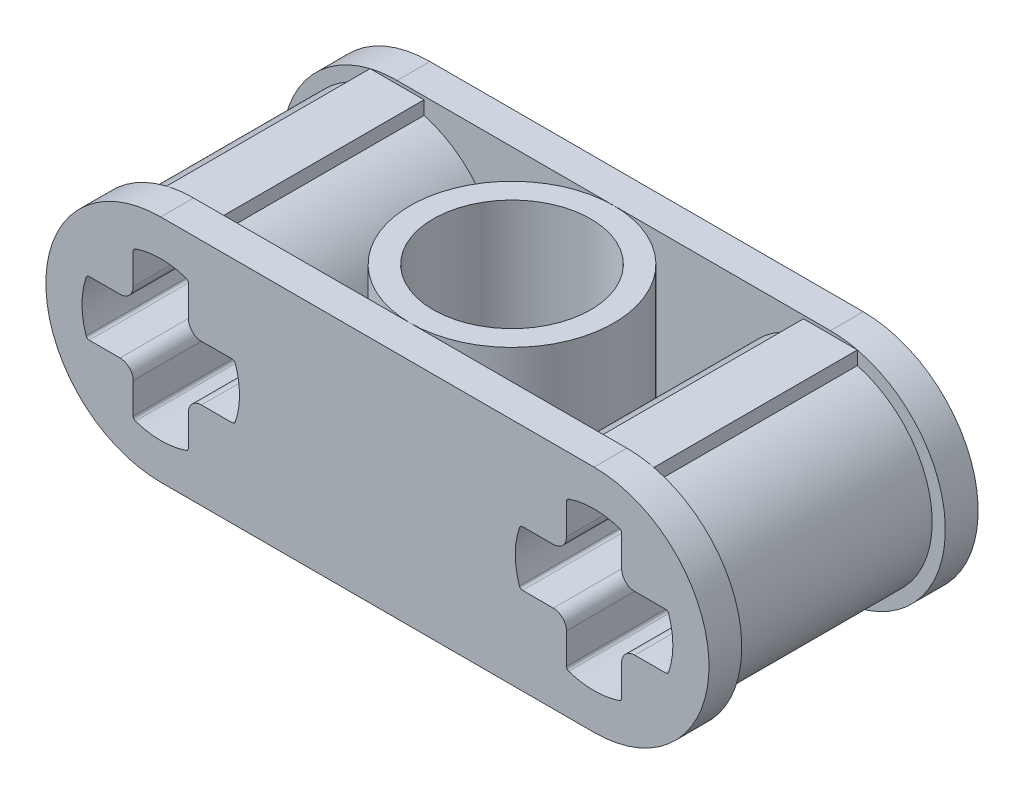
from build123d import *

# Parameters (mm, degrees)
BOSS_EXTRUDE1_DEPTH      = 10
BOSS_EXTRUDE2_DEPTH      = 35
BOSS_EXTRUDE2_DEPTH_BACK = 35
SKETCH2_R                = 31
SKETCH3_R                = 31
BOSS_EXTRUDE3_DEPTH      = 41
CUT_EXTRUDE1_DEPTH       = 41
FILLET1_R                = 4
FILLET2_R                = 4
FILLET3_R                = 4
FILLET4_R                = 4
FILLET5_R                = 1
FILLET6_R                = 1
FILLET7_R                = 1
FILLET8_R                = 1
FILLET9_R                = 1
FILLET10_R               = 1
FILLET11_R               = 1
FILLET12_R               = 1
BOSS_EXTRUDE4_DEPTH      = 41
MIRROR2_DEPTH            = 10
MIRROR2_START            = -31
MIRROR2_2_DEPTH          = 31
SKETCH6_R                = 24
CUT_EXTRUDE2_DEPTH       = 138.640836963
MIRROR3_START            = -72
MIRROR3_DEPTH            = 41
MIRROR3_2_DEPTH          = 10
SCALE1_SCALE             = 0.1


# Read off the part's stored shape, not the designer's step: Mirror2, Mirror3
with BuildPart() as part:
    # Sketch1 → Boss-Extrude1 (new body)
    with BuildSketch(Plane.XY):
        with BuildLine():
            Line((-66, 35), (66, 35))
            ThreePointArc((66, 35), (101, 0), (66, -35))
            Line((66, -35), (-66, -35))
            ThreePointArc((-66, -35), (-101, 0), (-66, 35))
        make_face()
    extrude(amount=BOSS_EXTRUDE1_DEPTH)

    # Sketch3 → Boss-Extrude3 (add)
    with BuildSketch(Plane.XY.offset(10)):
        with Locations((-66, 0)):
            Circle(SKETCH3_R)
    extrude(amount=-BOSS_EXTRUDE3_DEPTH)

    # Sketch4 → Cut-Extrude1 (cut)
    with BuildSketch(Plane.XY.offset(10)):
        with BuildLine():
            Line((-57.6, -8.4), (-43.518007206, -8.4))
            ThreePointArc((-43.518007206, -8.4), (-42, 0), (-43.518007206, 8.4))
            Line((-43.518007206, 8.4), (-57.6, 8.4))
            Line((-57.6, 8.4), (-57.6, 22.481992794))
            ThreePointArc((-57.6, 22.481992794), (-66, 24), (-74.4, 22.481992794))
            Line((-74.4, 22.481992794), (-74.4, 8.4))
            Line((-74.4, 8.4), (-88.481992794, 8.4))
            ThreePointArc((-88.481992794, 8.4), (-90, 0), (-88.481992794, -8.4))
            Line((-88.481992794, -8.4), (-74.4, -8.4))
            Line((-74.4, -8.4), (-74.4, -22.481992794))
            ThreePointArc((-74.4, -22.481992794), (-66, -24), (-57.6, -22.481992794))
            Line((-57.6, -22.481992794), (-57.6, -8.4))
        make_face()
    extrude(amount=-CUT_EXTRUDE1_DEPTH, mode=Mode.SUBTRACT)

    # Fillet1
    fillet1_edges = [part.edges().sort_by_distance(p)[0] for p in [
        (-57.6, 8.4, -10.5),
    ]]
    fillet(fillet1_edges, radius=FILLET1_R)

    # Fillet2
    fillet2_edges = [part.edges().sort_by_distance(p)[0] for p in [
        (-57.6, -8.4, -10.5),
    ]]
    fillet(fillet2_edges, radius=FILLET2_R)

    # Fillet3
    fillet3_edges = [part.edges().sort_by_distance(p)[0] for p in [
        (-74.4, -8.4, -10.5),
    ]]
    fillet(fillet3_edges, radius=FILLET3_R)

    # Fillet4
    fillet4_edges = [part.edges().sort_by_distance(p)[0] for p in [
        (-74.4, 8.4, -10.5),
    ]]
    fillet(fillet4_edges, radius=FILLET4_R)

    # Fillet5
    fillet5_edges = [part.edges().sort_by_distance(p)[0] for p in [
        (-74.4, -22.481992794, -10.5),
    ]]
    fillet(fillet5_edges, radius=FILLET5_R)

    # Fillet6
    fillet6_edges = [part.edges().sort_by_distance(p)[0] for p in [
        (-57.6, -22.481992794, -10.5),
    ]]
    fillet(fillet6_edges, radius=FILLET6_R)

    # Fillet7
    fillet7_edges = [part.edges().sort_by_distance(p)[0] for p in [
        (-43.518007206, -8.4, -10.5),
    ]]
    fillet(fillet7_edges, radius=FILLET7_R)

    # Fillet8
    fillet8_edges = [part.edges().sort_by_distance(p)[0] for p in [
        (-43.518007206, 8.4, -10.5),
    ]]
    fillet(fillet8_edges, radius=FILLET8_R)

    # Fillet9
    fillet9_edges = [part.edges().sort_by_distance(p)[0] for p in [
        (-88.481992794, -8.4, -10.5),
    ]]
    fillet(fillet9_edges, radius=FILLET9_R)

    # Fillet10
    fillet10_edges = [part.edges().sort_by_distance(p)[0] for p in [
        (-88.481992794, 8.4, -10.5),
    ]]
    fillet(fillet10_edges, radius=FILLET10_R)

    # Fillet11
    fillet11_edges = [part.edges().sort_by_distance(p)[0] for p in [
        (-74.4, 22.481992794, -10.5),
    ]]
    fillet(fillet11_edges, radius=FILLET11_R)

    # Fillet12
    fillet12_edges = [part.edges().sort_by_distance(p)[0] for p in [
        (-57.6, 22.481992794, -10.5),
    ]]
    fillet(fillet12_edges, radius=FILLET12_R)

    # Sketch5 → Boss-Extrude4 (add)
    with BuildSketch(Plane.XY.offset(10)):
        with BuildLine():
            Line((-74.212938845, 22.359401208), (-74.212938845, 34.022751734))
            Line((-74.212938845, 34.022751734), (-57.787061155, 34.022751734))
            Line((-57.787061155, 34.022751734), (-57.787061155, 22.359401208))
            ThreePointArc((-57.787061155, 22.359401208), (-58.004110065, 22.580118257), (-58.27826087, 22.723880496))
            ThreePointArc((-58.27826087, 22.723880496), (-66, 24), (-73.72173913, 22.723880496))
            ThreePointArc((-73.72173913, 22.723880496), (-73.995889935, 22.580118257), (-74.212938845, 22.359401208))
        make_face()
    boss_extrude4 = extrude(amount=-BOSS_EXTRUDE4_DEPTH)

    # Mirror1: Boss-Extrude4 across plane
    add(boss_extrude4.mirror(Plane.ZX))

    # Mirror2 outline → Mirror2 (cut)
    with BuildSketch(Plane.XY):
        with BuildLine():
            Line((44.222947858, -8.4), (53.6, -8.4))
            ThreePointArc((53.6, -8.4), (56.428427125, -9.571572875), (57.6, -12.4))
            Line((57.6, -12.4), (57.6, -21.777052142))
            ThreePointArc((57.6, -21.777052142), (57.787061155, -22.359401208), (58.27826087, -22.723880496))
            ThreePointArc((58.27826087, -22.723880496), (66, -24), (73.72173913, -22.723880496))
            ThreePointArc((73.72173913, -22.723880496), (74.212938845, -22.359401208), (74.4, -21.777052142))
            Line((74.4, -21.777052142), (74.4, -12.4))
            ThreePointArc((74.4, -12.4), (75.571572875, -9.571572875), (78.4, -8.4))
            Line((78.4, -8.4), (87.777052142, -8.4))
            ThreePointArc((87.777052142, -8.4), (88.359401208, -8.212938845), (88.723880496, -7.72173913))
            ThreePointArc((88.723880496, -7.72173913), (90, 0), (88.723880496, 7.72173913))
            ThreePointArc((88.723880496, 7.72173913), (88.359401208, 8.212938845), (87.777052142, 8.4))
            Line((87.777052142, 8.4), (78.4, 8.4))
            ThreePointArc((78.4, 8.4), (75.571572875, 9.571572875), (74.4, 12.4))
            Line((74.4, 12.4), (74.4, 21.777052142))
            ThreePointArc((74.4, 21.777052142), (74.212938845, 22.359401208), (73.72173913, 22.723880496))
            ThreePointArc((73.72173913, 22.723880496), (66, 24), (58.27826087, 22.723880496))
            ThreePointArc((58.27826087, 22.723880496), (57.787061155, 22.359401208), (57.6, 21.777052142))
            Line((57.6, 21.777052142), (57.6, 12.4))
            ThreePointArc((57.6, 12.4), (56.428427125, 9.571572875), (53.6, 8.4))
            Line((53.6, 8.4), (44.222947858, 8.4))
            ThreePointArc((44.222947858, 8.4), (43.640598792, 8.212938845), (43.276119504, 7.72173913))
            ThreePointArc((43.276119504, 7.72173913), (42, 0), (43.276119504, -7.72173913))
            ThreePointArc((43.276119504, -7.72173913), (43.640598792, -8.212938845), (44.222947858, -8.4))
        make_face()
    extrude(amount=MIRROR2_DEPTH, mode=Mode.SUBTRACT)

    # Mirror2 2 outline → Mirror2 2 (add)
    with BuildSketch(Plane.XY.offset(MIRROR2_START)):
        with BuildLine():
            Line((74.212938845, -34.022751734), (74.212938845, -29.892267153))
            ThreePointArc((74.212938845, -29.892267153), (97, 0), (74.212938845, 29.892267153))
            Line((74.212938845, 29.892267153), (74.212938845, 34.022751734))
            Line((74.212938845, 34.022751734), (57.787061155, 34.022751734))
            Line((57.787061155, 34.022751734), (57.787061155, 29.892267153))
            ThreePointArc((57.787061155, 29.892267153), (35, 0), (57.787061155, -29.892267153))
            Line((57.787061155, -29.892267153), (57.787061155, -34.022751734))
            Line((57.787061155, -34.022751734), (74.212938845, -34.022751734))
        make_face()
        with BuildLine():
            ThreePointArc((57.6, -12.4), (56.428427125, -9.571572875), (53.6, -8.4))
            Line((53.6, -8.4), (44.222947858, -8.4))
            ThreePointArc((44.222947858, -8.4), (43.640598792, -8.212938845), (43.276119504, -7.72173913))
            ThreePointArc((43.276119504, -7.72173913), (42, 0), (43.276119504, 7.72173913))
            ThreePointArc((43.276119504, 7.72173913), (43.640598792, 8.212938845), (44.222947858, 8.4))
            Line((44.222947858, 8.4), (53.6, 8.4))
            ThreePointArc((53.6, 8.4), (56.428427125, 9.571572875), (57.6, 12.4))
            Line((57.6, 12.4), (57.6, 21.777052142))
            ThreePointArc((57.6, 21.777052142), (57.787061155, 22.359401208), (58.27826087, 22.723880496))
            ThreePointArc((58.27826087, 22.723880496), (66, 24), (73.72173913, 22.723880496))
            ThreePointArc((73.72173913, 22.723880496), (74.212938845, 22.359401208), (74.4, 21.777052142))
            Line((74.4, 21.777052142), (74.4, 12.4))
            ThreePointArc((74.4, 12.4), (75.571572875, 9.571572875), (78.4, 8.4))
            Line((78.4, 8.4), (87.777052142, 8.4))
            ThreePointArc((87.777052142, 8.4), (88.359401208, 8.212938845), (88.723880496, 7.72173913))
            ThreePointArc((88.723880496, 7.72173913), (90, 0), (88.723880496, -7.72173913))
            ThreePointArc((88.723880496, -7.72173913), (88.359401208, -8.212938845), (87.777052142, -8.4))
            Line((87.777052142, -8.4), (78.4, -8.4))
            ThreePointArc((78.4, -8.4), (75.571572875, -9.571572875), (74.4, -12.4))
            Line((74.4, -12.4), (74.4, -21.777052142))
            ThreePointArc((74.4, -21.777052142), (74.212938845, -22.359401208), (73.72173913, -22.723880496))
            ThreePointArc((73.72173913, -22.723880496), (66, -24), (58.27826087, -22.723880496))
            ThreePointArc((58.27826087, -22.723880496), (57.787061155, -22.359401208), (57.6, -21.777052142))
            Line((57.6, -21.777052142), (57.6, -12.4))
        make_face(mode=Mode.SUBTRACT)
    extrude(amount=MIRROR2_2_DEPTH)

    # Mirror3 outline → Mirror3 (add)
    # profile 1 of 2: a face of its own
    with BuildSketch(Plane.XY.offset(MIRROR3_START)):
        with BuildLine():
            Line((74.212938845, -34.022751734), (74.212938845, -29.892267153))
            ThreePointArc((74.212938845, -29.892267153), (97, 0), (74.212938845, 29.892267153))
            Line((74.212938845, 29.892267153), (74.212938845, 34.022751734))
            Line((74.212938845, 34.022751734), (57.787061155, 34.022751734))
            Line((57.787061155, 34.022751734), (57.787061155, 29.892267153))
            ThreePointArc((57.787061155, 29.892267153), (35, 0), (57.787061155, -29.892267153))
            Line((57.787061155, -29.892267153), (57.787061155, -34.022751734))
            Line((57.787061155, -34.022751734), (74.212938845, -34.022751734))
        make_face()
        with BuildLine():
            ThreePointArc((57.6, -12.4), (56.428427125, -9.571572875), (53.6, -8.4))
            Line((53.6, -8.4), (44.222947858, -8.4))
            ThreePointArc((44.222947858, -8.4), (43.640598792, -8.212938845), (43.276119504, -7.72173913))
            ThreePointArc((43.276119504, -7.72173913), (42, 0), (43.276119504, 7.72173913))
            ThreePointArc((43.276119504, 7.72173913), (43.640598792, 8.212938845), (44.222947858, 8.4))
            Line((44.222947858, 8.4), (53.6, 8.4))
            ThreePointArc((53.6, 8.4), (56.428427125, 9.571572875), (57.6, 12.4))
            Line((57.6, 12.4), (57.6, 21.777052142))
            ThreePointArc((57.6, 21.777052142), (57.787061155, 22.359401208), (58.27826087, 22.723880496))
            ThreePointArc((58.27826087, 22.723880496), (66, 24), (73.72173913, 22.723880496))
            ThreePointArc((73.72173913, 22.723880496), (74.212938845, 22.359401208), (74.4, 21.777052142))
            Line((74.4, 21.777052142), (74.4, 12.4))
            ThreePointArc((74.4, 12.4), (75.571572875, 9.571572875), (78.4, 8.4))
            Line((78.4, 8.4), (87.777052142, 8.4))
            ThreePointArc((87.777052142, 8.4), (88.359401208, 8.212938845), (88.723880496, 7.72173913))
            ThreePointArc((88.723880496, 7.72173913), (90, 0), (88.723880496, -7.72173913))
            ThreePointArc((88.723880496, -7.72173913), (88.359401208, -8.212938845), (87.777052142, -8.4))
            Line((87.777052142, -8.4), (78.4, -8.4))
            ThreePointArc((78.4, -8.4), (75.571572875, -9.571572875), (74.4, -12.4))
            Line((74.4, -12.4), (74.4, -21.777052142))
            ThreePointArc((74.4, -21.777052142), (74.212938845, -22.359401208), (73.72173913, -22.723880496))
            ThreePointArc((73.72173913, -22.723880496), (66, -24), (58.27826087, -22.723880496))
            ThreePointArc((58.27826087, -22.723880496), (57.787061155, -22.359401208), (57.6, -21.777052142))
            Line((57.6, -21.777052142), (57.6, -12.4))
        make_face(mode=Mode.SUBTRACT)
    # profile 2 of 2: a face of its own
    with BuildSketch(Plane.XY.offset(MIRROR3_START)):
        with BuildLine():
            Line((-74.212938845, -29.892267153), (-74.212938845, -34.022751734))
            Line((-74.212938845, -34.022751734), (-57.787061155, -34.022751734))
            Line((-57.787061155, -34.022751734), (-57.787061155, -29.892267153))
            ThreePointArc((-57.787061155, -29.892267153), (-35, 0), (-57.787061155, 29.892267153))
            Line((-57.787061155, 29.892267153), (-57.787061155, 34.022751734))
            Line((-57.787061155, 34.022751734), (-74.212938845, 34.022751734))
            Line((-74.212938845, 34.022751734), (-74.212938845, 29.892267153))
            ThreePointArc((-74.212938845, 29.892267153), (-97, 0), (-74.212938845, -29.892267153))
        make_face()
        with BuildLine():
            ThreePointArc((-58.27826087, -22.723880496), (-66, -24), (-73.72173913, -22.723880496))
            ThreePointArc((-73.72173913, -22.723880496), (-74.212938845, -22.359401208), (-74.4, -21.777052142))
            Line((-74.4, -21.777052142), (-74.4, -12.4))
            ThreePointArc((-74.4, -12.4), (-75.571572875, -9.571572875), (-78.4, -8.4))
            Line((-78.4, -8.4), (-87.777052142, -8.4))
            ThreePointArc((-87.777052142, -8.4), (-88.359401208, -8.212938845), (-88.723880496, -7.72173913))
            ThreePointArc((-88.723880496, -7.72173913), (-90, 0), (-88.723880496, 7.72173913))
            ThreePointArc((-88.723880496, 7.72173913), (-88.359401208, 8.212938845), (-87.777052142, 8.4))
            Line((-87.777052142, 8.4), (-78.4, 8.4))
            ThreePointArc((-78.4, 8.4), (-75.571572875, 9.571572875), (-74.4, 12.4))
            Line((-74.4, 12.4), (-74.4, 21.777052142))
            ThreePointArc((-74.4, 21.777052142), (-74.212938845, 22.359401208), (-73.72173913, 22.723880496))
            ThreePointArc((-73.72173913, 22.723880496), (-66, 24), (-58.27826087, 22.723880496))
            ThreePointArc((-58.27826087, 22.723880496), (-57.787061155, 22.359401208), (-57.6, 21.777052142))
            Line((-57.6, 21.777052142), (-57.6, 12.4))
            ThreePointArc((-57.6, 12.4), (-56.428427125, 9.571572875), (-53.6, 8.4))
            Line((-53.6, 8.4), (-44.222947858, 8.4))
            ThreePointArc((-44.222947858, 8.4), (-43.640598792, 8.212938845), (-43.276119504, 7.72173913))
            ThreePointArc((-43.276119504, 7.72173913), (-42, 0), (-43.276119504, -7.72173913))
            ThreePointArc((-43.276119504, -7.72173913), (-43.640598792, -8.212938845), (-44.222947858, -8.4))
            Line((-44.222947858, -8.4), (-53.6, -8.4))
            ThreePointArc((-53.6, -8.4), (-56.428427125, -9.571572875), (-57.6, -12.4))
            Line((-57.6, -12.4), (-57.6, -21.777052142))
            ThreePointArc((-57.6, -21.777052142), (-57.787061155, -22.359401208), (-58.27826087, -22.723880496))
        make_face(mode=Mode.SUBTRACT)
    extrude(amount=MIRROR3_DEPTH)

    # Mirror3 2 outline → Mirror3 2 (add)
    with BuildSketch(Plane.XY.offset(MIRROR3_START)):
        with BuildLine():
            ThreePointArc((74.212938845, 29.892267153), (97, 0), (74.212938845, -29.892267153))
            Line((74.212938845, -29.892267153), (74.212938845, -34.022751734))
            ThreePointArc((74.212938845, -34.022751734), (101, 0), (74.212938845, 34.022751734))
            Line((74.212938845, 34.022751734), (74.212938845, 29.892267153))
        make_face()
        with BuildLine():
            ThreePointArc((66, -35), (70.135437663, -34.754829238), (74.212938845, -34.022751734))
            Line((74.212938845, -34.022751734), (57.787061155, -34.022751734))
            Line((57.787061155, -34.022751734), (57.787061155, -29.892267153))
            ThreePointArc((57.787061155, -29.892267153), (35, 0), (57.787061155, 29.892267153))
            Line((57.787061155, 29.892267153), (57.787061155, 34.022751734))
            Line((57.787061155, 34.022751734), (74.212938845, 34.022751734))
            ThreePointArc((74.212938845, 34.022751734), (70.135437663, 34.754829238), (66, 35))
            Line((66, 35), (-66, 35))
            ThreePointArc((-66, 35), (-70.135437663, 34.754829238), (-74.212938845, 34.022751734))
            Line((-74.212938845, 34.022751734), (-57.787061155, 34.022751734))
            Line((-57.787061155, 34.022751734), (-57.787061155, 29.892267153))
            ThreePointArc((-57.787061155, 29.892267153), (-35, 0), (-57.787061155, -29.892267153))
            Line((-57.787061155, -29.892267153), (-57.787061155, -34.022751734))
            Line((-57.787061155, -34.022751734), (-74.212938845, -34.022751734))
            ThreePointArc((-74.212938845, -34.022751734), (-70.135437663, -34.754829238), (-66, -35))
            Line((-66, -35), (66, -35))
        make_face()
        with BuildLine():
            ThreePointArc((-74.212938845, 34.022751734), (-101, 0), (-74.212938845, -34.022751734))
            Line((-74.212938845, -34.022751734), (-74.212938845, -29.892267153))
            ThreePointArc((-74.212938845, -29.892267153), (-97, 0), (-74.212938845, 29.892267153))
            Line((-74.212938845, 29.892267153), (-74.212938845, 34.022751734))
        make_face()
    extrude(amount=MIRROR3_2_DEPTH)


with BuildPart() as body_2:
    # Sketch2 → Boss-Extrude2 (new, two sides: drawn at the far end of the back side and taken through both)
    with BuildSketch(Plane(origin=(0, 0, 0), x_dir=(1, 0, 0), z_dir=(0, 1, 0)).offset(-BOSS_EXTRUDE2_DEPTH_BACK)):
        with Locations(Location((0, 31, 0), (0, 0, 270))):
            Circle(SKETCH2_R)
    extrude(amount=BOSS_EXTRUDE2_DEPTH + BOSS_EXTRUDE2_DEPTH_BACK)

    # Sketch6 → Cut-Extrude2 (cut, through all)
    with BuildSketch(Plane(origin=(0, 35, 0), x_dir=(1, 0, 0), z_dir=(0, 1, 0))):
        with Locations(Location((0, 31, 0), (0, 0, 270))):
            Circle(SKETCH6_R)
    extrude(amount=-CUT_EXTRUDE2_DEPTH, mode=Mode.SUBTRACT)


with BuildPart() as body_2_1:
    # Scale1: scaled about (0, 0, 0)
    add(body_2.part.scale(SCALE1_SCALE))


with BuildPart() as part_1:
    # Scale1: scaled about (0, 0, 0)
    add(part.part.scale(SCALE1_SCALE))


solid = Compound([body_2_1.part, part_1.part])
